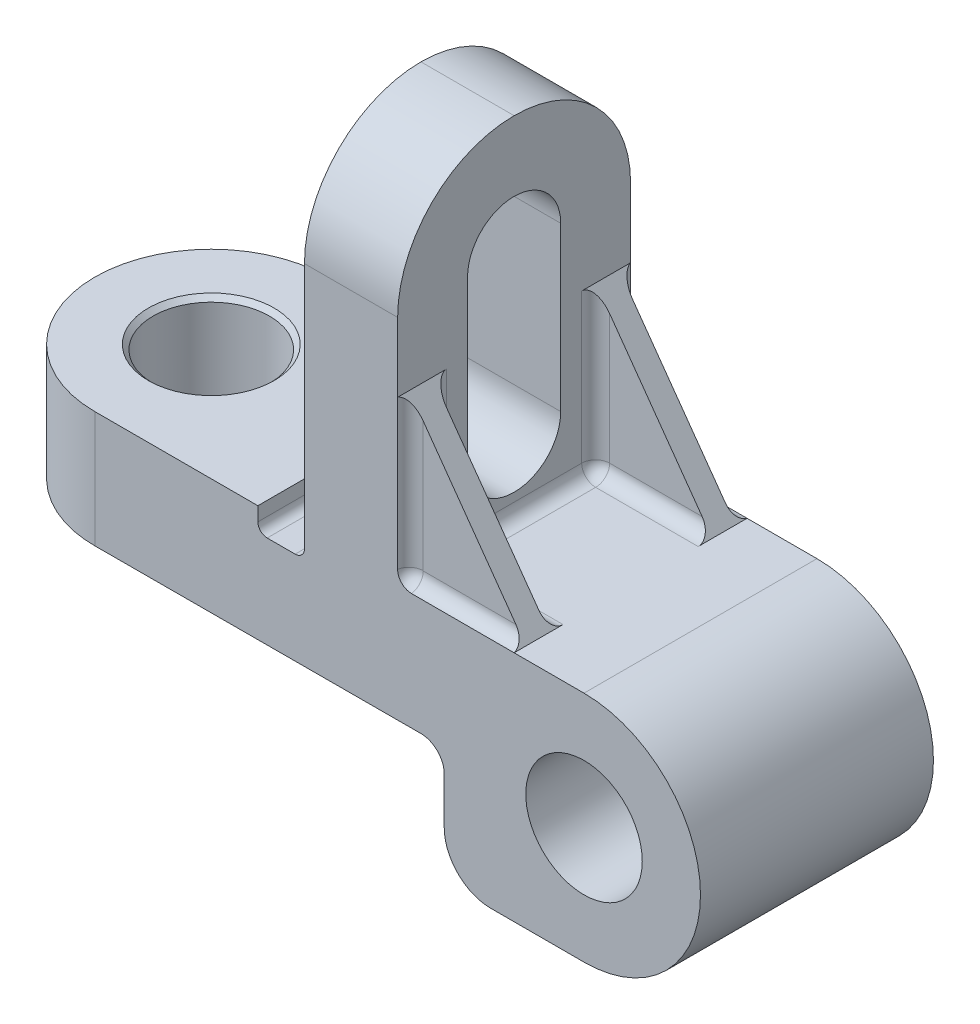
from build123d import *

# Parameters (mm, degrees)
ESBO_O1_R                              = 12.5
RESSALTO_EXTRUS_O1_DEPTH               = 25
FILETE1_R                              = 10
FILETE2_R                              = 5
FILETE3_R                              = 3
FILETE4_R                              = 2
FILETE5_R                              = 25
FURO_DE_DI_METRO_25_0_25_1_D           = 25
FURO_DE_DI_METRO_25_0_25_1_CSINK_D     = 27
FURO_DE_DI_METRO_25_0_25_1_CSINK_ANGLE = 90
CORTE_EXTRUS_O1_DEPTH                  = 50
NERVURA1_REACH                         = 191.868
ESBO_O6_WALL_W                         = 424.748377256
ESBO_O6_WALL_H                         = 5
FILETE6_R                              = 3


with BuildPart() as part:
    # Esboço1 → Ressalto-extrusão1 (new, symmetric)
    with BuildSketch(Plane.XY):
        with BuildLine():
            Line((0, 0), (0, 25))
            Line((0, 25), (60, 25))
            Line((60, 25), (60, 20))
            Line((60, 20), (70, 20))
            Line((70, 20), (70, 100))
            Line((70, 100), (90, 100))
            Line((90, 100), (90, 25.160806235))
            Line((90, 25.160806235), (130, 25.160806235))
            ThreePointArc((130, 25.160806235), (155, 0.160806235), (130, -24.839193765))
            Line((130, -24.839193765), (100, -24.839193765))
            Line((100, -24.839193765), (100, 0.160806235))
            Line((100, 0.160806235), (0, 0))
        make_face()
        with Locations((130, 0.160806235)):
            Circle(ESBO_O1_R, mode=Mode.SUBTRACT)
    extrude(amount=RESSALTO_EXTRUS_O1_DEPTH, both=True)

    # Filete1
    filete1_edges = [part.edges().sort_by_distance(p)[0] for p in [
        (100, -24.839193765, 0),
    ]]
    fillet(filete1_edges, radius=FILETE1_R)

    # Filete2
    filete2_edges = [part.edges().sort_by_distance(p)[0] for p in [
        (100, 0.160806235, 0),
    ]]
    fillet(filete2_edges, radius=FILETE2_R)

    # Filete3
    filete3_edges = [part.edges().sort_by_distance(p)[0] for p in [
        (90, 25.160806235, 0),
    ]]
    fillet(filete3_edges, radius=FILETE3_R)

    # Filete4
    filete4_edges = [part.edges().sort_by_distance(p)[0] for p in [
        (60, 20, 0),
        (70, 20, 0),
    ]]
    fillet(filete4_edges, radius=FILETE4_R)

    # Filete5
    filete5_edges = [part.edges().sort_by_distance(p)[0] for p in [
        (0, 12.5, -25),
        (0, 12.5, 25),
        (80, 100, 25),
        (80, 100, -25),
    ]]
    fillet(filete5_edges, radius=FILETE5_R - 0.0001)  # a hair under: the kernel refuses the full size

    # Furo de diâmetro Ø25.0 (25)1 (through all)
    with Locations(Plane(origin=(0, 25, 0), x_dir=(1, 0, 0), z_dir=(0, 1, 0))):
        with Locations((25, 0)):
            CounterSinkHole(FURO_DE_DI_METRO_25_0_25_1_D / 2, FURO_DE_DI_METRO_25_0_25_1_CSINK_D / 2, counter_sink_angle=FURO_DE_DI_METRO_25_0_25_1_CSINK_ANGLE)

    # Esboço5 → Corte-extrusão1 (cut)
    with BuildSketch(Plane.ZY.offset(-70)):
        with BuildLine():
            Line((10, 75), (10, 40))
            ThreePointArc((10, 40), (0, 30), (-10, 40))
            Line((-10, 40), (-10, 75))
            ThreePointArc((-10, 75), (0, 85), (10, 75))
        make_face()
    extrude(amount=-CORTE_EXTRUS_O1_DEPTH, mode=Mode.SUBTRACT)

    # Esboço6 wall → Nervura1 (add, up to next)
    with BuildSketch(Plane(origin=(102.5, 42.660806235, 20), x_dir=(0.581238193719, -0.813733471207, 0), z_dir=(0.813733471207, 0.581238193719, 0)), mode=Mode.PRIVATE) as nervura1_sk1:
        Rectangle(ESBO_O6_WALL_W, ESBO_O6_WALL_H)
    nervura1_tool1 = extrude(nervura1_sk1.sketch, amount=-NERVURA1_REACH, mode=Mode.PRIVATE) - part.part
    add(nervura1_tool1.solids().sort_by_distance((102.5, 42.660806235, 20))[0])

    # Filete6
    # the kernel refuses this fillet: 3 mm, written as the material it adds along each edge
    with BuildSketch(Plane(origin=(122.5, 25.160806235, 17.5), x_dir=(0, 0, -1), z_dir=(-1, 0, 0))) as filete6_piece_1_section:
        with BuildLine():
            CenterArc((FILETE6_R, -FILETE6_R), FILETE6_R, 90, 90)
            Line((0, -FILETE6_R), (0, 0))
            Line((0, 0), (FILETE6_R, 0))
        make_face()
    filete6_piece_1 = extrude(amount=29.5, mode=Mode.PRIVATE)
    filete6_piece_1 = split(filete6_piece_1, bisect_by=Plane(origin=(117.533783784, 21.613508937, 17.5), z_dir=(-0.8137334712068701, -0.5812381937189072, 0)), keep=Keep.TOP, mode=Mode.PRIVATE)
    add(filete6_piece_1)
    with BuildSketch(Plane(origin=(93, 28.160806235, 17.5), x_dir=(0, -1, 0), z_dir=(1, 0, 0))) as filete6_piece_2:
        with BuildLine():
            CenterArc((3 - FILETE6_R, FILETE6_R), FILETE6_R, 270, 90)
            Line((3, FILETE6_R), (3, 0))
            Line((3, 0), (3 - FILETE6_R, 0))
        make_face()
    revolve(axis=Axis((93, 28.160806235, 17.5), (0, 0, -1)), revolution_arc=90)
    with BuildSketch(Plane(origin=(90, 28.160806235, 17.5), x_dir=(0, 0, -1), z_dir=(0, 1, 0))) as filete6_piece_3_section:
        with BuildLine():
            CenterArc((FILETE6_R, -FILETE6_R), FILETE6_R, 90, 90)
            Line((0, -FILETE6_R), (0, 0))
            Line((0, 0), (FILETE6_R, 0))
        make_face()
    filete6_piece_3 = extrude(amount=39.5, mode=Mode.PRIVATE)
    filete6_piece_3 = split(filete6_piece_3, bisect_by=Plane(origin=(105.135135135, 38.971617046, 17.5), z_dir=(-0.8137334712068701, -0.5812381937189072, 0)), keep=Keep.TOP, mode=Mode.PRIVATE)
    add(filete6_piece_3)
    with BuildSketch(Plane(origin=(93, 25.160806235, 22.5), x_dir=(0, 0, 1), z_dir=(1, 0, 0))) as filete6_piece_4_section:
        with BuildLine():
            CenterArc((3, -2.958039892), FILETE6_R, 99.594068227, 80.405931773)
            Line((0, -2.958039892), (0, 0))
            Line((0, 0), (2.5, 0))
        make_face()
    filete6_piece_4 = extrude(amount=29.395099729, mode=Mode.PRIVATE)
    filete6_piece_4 = split(filete6_piece_4, bisect_by=Plane(origin=(107.567567568, 35.56621164, 22.5), z_dir=(-0.8137334712068701, -0.5812381937189072, 0)), keep=Keep.TOP, mode=Mode.PRIVATE)
    add(filete6_piece_4)
    with BuildSketch(Plane(origin=(93, 28.160806235, 22.5), x_dir=(0, -1, 0), z_dir=(1, 0, 0))) as filete6_piece_5:
        with BuildLine():
            CenterArc((0.041960108, -3), FILETE6_R, 9.594068227, 80.405931773)
            Line((0.041960108, 0), (3, 0))
            Line((3, 0), (3, -2.5))
        make_face()
    revolve(axis=Axis((93, 28.160806235, 22.5), (0, 0, -1)), revolution_arc=90)
    with BuildSketch(Plane(origin=(90, 67.555905964, 22.5), x_dir=(0, 0, 1), z_dir=(0, -1, 0))) as filete6_piece_6_section:
        with BuildLine():
            CenterArc((3, -2.958039892), FILETE6_R, 99.594068227, 80.405931773)
            Line((0, -2.958039892), (0, 0))
            Line((0, 0), (2.5, 0))
        make_face()
    filete6_piece_6 = extrude(amount=39.395099729, mode=Mode.PRIVATE)
    filete6_piece_6 = split(filete6_piece_6, bisect_by=Plane(origin=(86.502317696, 65.057561461, 22.5), z_dir=(-0.8137334712068701, -0.5812381937189072, 0)), keep=Keep.TOP, mode=Mode.PRIVATE)
    add(filete6_piece_6)

    # Espelhar1: read off the stored shape, not the designer's step
    # Espelhar1: part across plane


with BuildPart() as part_1:
    add(part.part)
    add(part.part.mirror(Plane.XY))


solid = part_1.part
